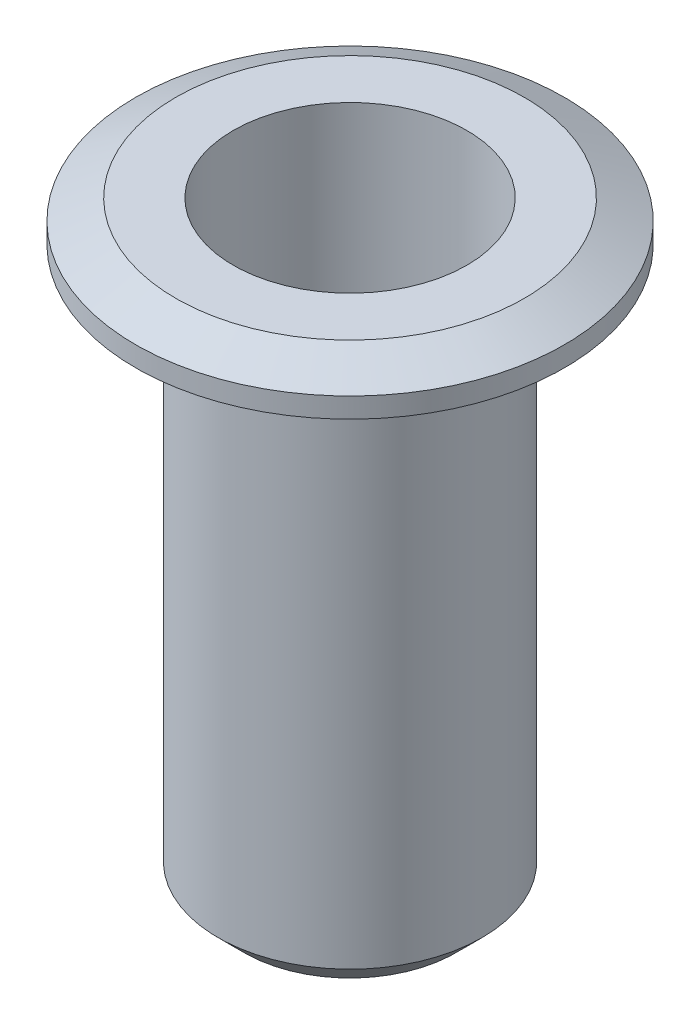
from build123d import *

# Parameters (mm, degrees)
CUT_SWEEP1_PITCH = 0.79375


with BuildPart() as part:
    # Sketch1 → Revolve1 (revolve)
    with BuildSketch(Plane.XY):
        Polygon((-3.175, -13.823553125), (-2.545953125, -14.4526), (-2.413, -14.4526), (-1.91690625, -13.95650625), (-1.91690625, -5.69356875), (-2.809875, -4.8006), (-2.809875, 0), (-4.191, 0), (-5.1562, -0.4826), (-5.1562, -0.9652), (-3.175, -0.9652), align=None)
    revolve(axis=Axis((0, 0, 0), (0, -1, 0)))

    # Cut-Sweep1: the profile of Sketch3 screwed along a right-hand helix of 28.045096 turns, 8 arcs to a turn; built about Z, then put on its axis
    cut_sweep1_z = Axis((0, 0, 0), (0, 0, 1))
    cut_sweep1_corners = [(1.854481273, 0, 0.322460938), (1.854481273, 0, -0.421679688), (2.413, 0, -0.09921875), (2.441641986, 0, -0.049609375), (2.413, 0, 0)]
    with BuildLine(mode=Mode.PRIVATE) as cut_sweep1_profile:
        Line(cut_sweep1_corners[0], cut_sweep1_corners[1])
        Line(cut_sweep1_corners[1], cut_sweep1_corners[2])
        Line(cut_sweep1_corners[4], cut_sweep1_corners[0])
        ThreePointArc((2.413, 0, -0.09921875), (2.433967389, 0, -0.078251361), (2.441641986, 0, -0.049609375))
        ThreePointArc((2.441641986, 0, -0.049609375), (2.433967389, 0, -0.020967389), (2.413, 0, 0))
    cut_sweep1_cap = Face(cut_sweep1_profile.wire())
    cut_sweep1_arcs = [((2.413, 0, -0.09921875), (2.441641986, 0, -0.082682292), (2.441641986, 0, -0.049609375), (1, 0.8660254037844495, 1)), ((2.441641986, 0, -0.049609375), (2.441641986, 0, -0.016536458), (2.413, 0, 0), (1, 0.8660254037844495, 1))]  # start, shoulder, end, weights
    cut_sweep1_turn_angles = [0, 22.5, 45, 67.5, 90, 112.5, 135, 157.5, 180, 202.5, 225, 247.5, 270, 292.5, 315, 337.5, 360]
    cut_sweep1_turn_weights = [1, 0.9238795325112867, 1, 0.9238795325112867, 1, 0.9238795325112867, 1, 0.9238795325112867, 1, 0.9238795325112867, 1, 0.9238795325112867, 1, 0.9238795325112867, 1, 0.9238795325112867, 1]
    cut_sweep1_turn_rails = [Edge.make_bspline([Vector(p[0], p[1], 0).rotate(cut_sweep1_z, cut_sweep1_turn_angles[k]) / cut_sweep1_turn_weights[k] + Vector(0, 0, p[2] + CUT_SWEEP1_PITCH * cut_sweep1_turn_angles[k] / 360) for k in range(17)], [0, 0, 0, 1, 1, 2, 2, 3, 3, 4, 4, 5, 5, 6, 6, 7, 7, 8, 8, 8], 2, cut_sweep1_turn_weights) for p in cut_sweep1_corners]
    cut_sweep1_turn_sides = [*[Face.make_surface_from_curves(cut_sweep1_turn_rails[p[0]], cut_sweep1_turn_rails[p[1]]) for p in [(0, 1), (1, 2), (4, 0)]], *[Face.make_bezier_surface([[Vector(p[j][0], p[j][1], 0).rotate(cut_sweep1_z, cut_sweep1_turn_angles[2 * i + k]) / cut_sweep1_turn_weights[2 * i + k] + Vector(0, 0, p[j][2] + CUT_SWEEP1_PITCH * cut_sweep1_turn_angles[2 * i + k] / 360) for k in range(3)] for j in range(3)], [[p[3][j] * cut_sweep1_turn_weights[2 * i + k] for k in range(3)] for j in range(3)]) for p in cut_sweep1_arcs for i in range(8)]]
    cut_sweep1_last_angles = [10080, 10088.117368468, 10096.234736935]
    cut_sweep1_last_weights = [1, 0.9899808998602304, 1]
    cut_sweep1_last_rails = [Edge.make_bspline([Vector(p[0], p[1], 0).rotate(cut_sweep1_z, cut_sweep1_last_angles[k]) / cut_sweep1_last_weights[k] + Vector(0, 0, p[2] + CUT_SWEEP1_PITCH * cut_sweep1_last_angles[k] / 360) for k in range(3)], [0, 0, 0, 1, 1, 1], 2, cut_sweep1_last_weights) for p in cut_sweep1_corners]
    cut_sweep1_last_sides = [*[Face.make_surface_from_curves(cut_sweep1_last_rails[p[0]], cut_sweep1_last_rails[p[1]]) for p in [(0, 1), (1, 2), (4, 0)]], *[Face.make_bezier_surface([[Vector(p[j][0], p[j][1], 0).rotate(cut_sweep1_z, cut_sweep1_last_angles[2 * i + k]) / cut_sweep1_last_weights[2 * i + k] + Vector(0, 0, p[j][2] + CUT_SWEEP1_PITCH * cut_sweep1_last_angles[2 * i + k] / 360) for k in range(3)] for j in range(3)], [[p[3][j] * cut_sweep1_last_weights[2 * i + k] for k in range(3)] for j in range(3)]) for p in cut_sweep1_arcs for i in range(1)]]
    cut_sweep1 = Plane(origin=(0, -14.4526, 0), x_dir=(1, 0, 0), z_dir=(0, 1, 0)) * Solid(Shell([*[p.moved(Location((0, 0, CUT_SWEEP1_PITCH * i))) for i in range(28) for p in cut_sweep1_turn_sides], *cut_sweep1_last_sides, cut_sweep1_cap, cut_sweep1_cap.rotate(cut_sweep1_z, 10096.234736935).moved(Location((0, 0, CUT_SWEEP1_PITCH * 10096.234736935 / 360)))]))
    add(cut_sweep1, mode=Mode.SUBTRACT)


solid = part.part
